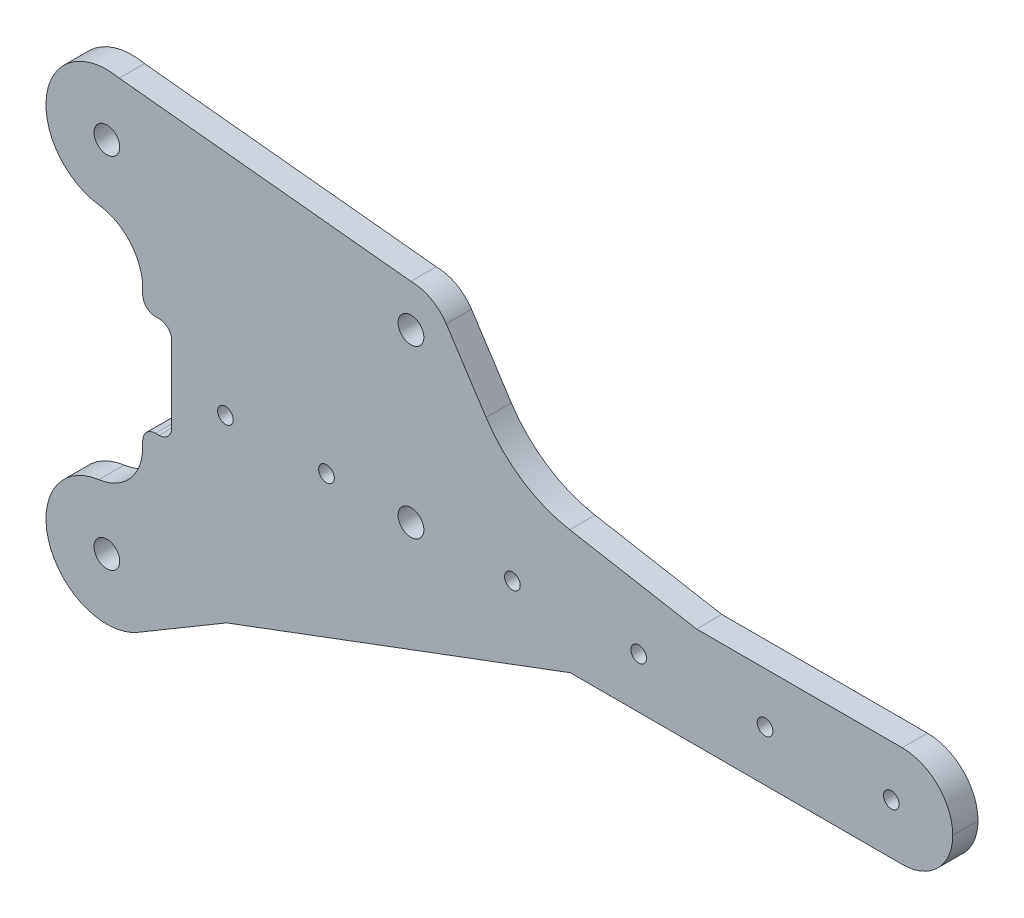
from build123d import *
from OCP.BRepFilletAPI import BRepFilletAPI_MakeChamfer

# Parameters (mm, degrees)
CROQUIS1_R              = 1.549999999999994
CROQUIS1_R_2            = 2.5499999999999923
CROQUIS1_R_3            = 2.5500000000020107
CROQUIS1_R_4            = 2.5499999999987524
CROQUIS1_R_5            = 1.5500000000000012
SALIENTE_EXTRUIR1_DEPTH = 5
REDONDEO1_R             = 10
REDONDEO2_R             = 10
REDONDEO4_R             = 2.5
CHAFL_N1_SIZE           = 50
CHAFL_N1_SIZE2          = 25
CROQUIS2_R              = 2.5499999999999914
SALIENTE_EXTRUIR2_DEPTH = 5
REDONDEO5_R             = 25


with BuildPart() as part:
    # Croquis1 → Saliente-Extruir1 (new body)
    with BuildSketch(Plane.XY):
        with BuildLine():
            Line((22.499999999999602, 23.448771432804598), (22.499999999999606, 10.00000000000557))
            Line((22.499999999999606, 10.00000000000557), (28.23305122348206, 10.00000000000557))
            Line((28.23305122348206, 10.00000000000557), (28.233051223482065, -9.999999999994426))
            Line((28.233051223482065, -9.999999999994426), (22.49999999999961, -9.99999999999443))
            Line((22.49999999999961, -9.99999999999443), (22.49999999999961, -20.499999999994426))
            Line((22.49999999999961, -20.499999999994426), (22.49999999999961, -23.448771432804598))
            Line((22.49999999999961, -23.448771432804598), (15.3999999999996, -23.448771432804598))
            ThreePointArc((15.3999999999996, -23.448771432804598), (3.787647475656714, -38.722635385727685), (21.610549895016423, -45.827689963420795))
            Line((21.610549895016423, -45.827689963420795), (23.615707001015654, -44.64130534237437))
            Line((23.615707001015654, -44.64130534237437), (79.74064487017472, -11.416377836244111))
            Line((79.74064487017472, -11.416377836244111), (82.13324958071296, -10))
            Line((82.13324958071296, -10), (182.8500644459697, -9.999999999999998))
            Line((182.8500644459697, -9.999999999999998), (182.8500644459697, 9.999999999999998))
            Line((182.8500644459697, 9.999999999999998), (87.50000000000001, 9.999999999999998))
            Line((87.50000000000001, 9.999999999999998), (82.13324958071296, 9.999999999999998))
            Line((82.13324958071296, 9.999999999999998), (23.615707001015654, 44.64130534237437))
            Line((23.615707001015654, 44.64130534237437), (21.610549895016423, 45.827689963420795))
            ThreePointArc((21.610549895016423, 45.827689963420795), (3.787647475656714, 38.722635385727685), (15.3999999999996, 23.448771432804598))
            Line((15.3999999999996, 23.448771432804598), (22.499999999999602, 23.448771432804598))
        make_face()
        with Locations((170.68634124367938, 0)):
            Circle(CROQUIS1_R, mode=Mode.SUBTRACT)
        with Locations((75.6, 0)):
            Circle(CROQUIS1_R_2, mode=Mode.SUBTRACT)
        with Locations((15.3999999999996, -35.50000000000558)):
            Circle(CROQUIS1_R_3, mode=Mode.SUBTRACT)
        with Locations((15.3999999999996, 35.50000000000558)):
            Circle(CROQUIS1_R_4, mode=Mode.SUBTRACT)
        with Locations((95.6863412436794, 0)):
            Circle(CROQUIS1_R, mode=Mode.SUBTRACT)
        with Locations((145.68634124367938, 0)):
            Circle(CROQUIS1_R, mode=Mode.SUBTRACT)
        with Locations((120.68634124367938, 0)):
            Circle(CROQUIS1_R, mode=Mode.SUBTRACT)
        with Locations((38.875017115898416, 0)):
            Circle(CROQUIS1_R_5, mode=Mode.SUBTRACT)
        with Locations((58.875017115898416, -1.73e-15)):
            Circle(CROQUIS1_R_5, mode=Mode.SUBTRACT)
    extrude(amount=SALIENTE_EXTRUIR1_DEPTH)

    # Redondeo1
    redondeo1_edges = [part.edges().sort_by_distance(p)[0] for p in [
        (22.49999999999961, -23.448771432804598, 2.5),
        (22.499999999999602, 23.448771432804598, 2.5),
    ]]
    fillet(redondeo1_edges, radius=REDONDEO1_R)

    # Redondeo2
    redondeo2_edges = [part.edges().sort_by_distance(p)[0] for p in [
        (182.8500644459697, -9.999999999999998, 2.5),
        (182.8500644459697, 9.999999999999998, 2.5),
    ]]
    fillet(redondeo2_edges, radius=REDONDEO2_R - 0.0001)  # a hair under: the kernel refuses the full size

    # Redondeo4
    redondeo4_edges = [part.edges().sort_by_distance(p)[0] for p in [
        (22.49999999999961, -9.99999999999443, 2.5),
        (28.233051223482065, -9.999999999994426, 2.5),
        (28.23305122348206, 10.00000000000557, 2.5),
        (22.499999999999606, 10.00000000000557, 2.5),
    ]]
    fillet(redondeo4_edges, radius=REDONDEO4_R)

    # Chaflán1: one chamfer whose edges measure the first distance from different faces: ONE call of the kernel's chamfer builder (chamfer() names one face for all edges)
    chafl_n1_edges_1 = [part.edges().sort_by_distance(p)[0] for p in [
        (82.13324958071296, 9.999999999999998, 2.5),
    ]]
    chafl_n1_side_1 = [part.faces().sort_by_distance(p)[0] for p in [
        (127.49170701334134, 9.999999999999998, 2.5),
    ]]
    chafl_n1_edges_2 = [part.edges().sort_by_distance(p)[0] for p in [
        (82.13324958071296, -10, 2.5),
    ]]
    chafl_n1_side_2 = [part.faces().sort_by_distance(p)[0] for p in [
        (52.874478290864296, -27.320652671187155, 2.5),
    ]]
    chafl_n1 = BRepFilletAPI_MakeChamfer(part.part.solid().wrapped)
    for e in chafl_n1_edges_1:
        chafl_n1.Add(CHAFL_N1_SIZE, CHAFL_N1_SIZE2, e.wrapped, chafl_n1_side_1[0].wrapped)  # the first distance lies on this face
    for e in chafl_n1_edges_2:
        chafl_n1.Add(CHAFL_N1_SIZE, CHAFL_N1_SIZE2, e.wrapped, chafl_n1_side_2[0].wrapped)  # the first distance lies on this face
    add(Compound.cast(chafl_n1.Shape()), mode=Mode.REPLACE)

    # Croquis2 → Saliente-Extruir2 (add)
    with BuildSketch(Plane(origin=(0, 0, 0), x_dir=(-1, 0, 0), z_dir=(0, 0, -1))):
        with BuildLine():
            Line((-96.37672384904373, 16.36766473551684), (-82.582860744419, 37.547706950275206))
            ThreePointArc((-82.582860744419, 37.547706950275206), (-79.57146676248833, 40.32594256297316), (-75.59999999999961, 41.33318562624969))
            Line((-75.59999999999961, 41.33318562624969), (-15.399999999999643, 47.55122856720654))
            Line((-15.399999999999643, 47.55122856720654), (-60.62019811737546, 22.735329471033683))
            Line((-60.62019811737546, 22.735329471033683), (-96.37672384904373, 16.36766473551684))
        make_face()
        with Locations((-75.59999999999961, 33)):
            Circle(CROQUIS2_R, mode=Mode.SUBTRACT)
    extrude(amount=-SALIENTE_EXTRUIR2_DEPTH)

    # Redondeo5
    redondeo5_edges = [part.edges().sort_by_distance(p)[0] for p in [
        (96.37672384904373, 16.36766473551684, 2.5),
    ]]
    fillet(redondeo5_edges, radius=REDONDEO5_R)


solid = part.part
